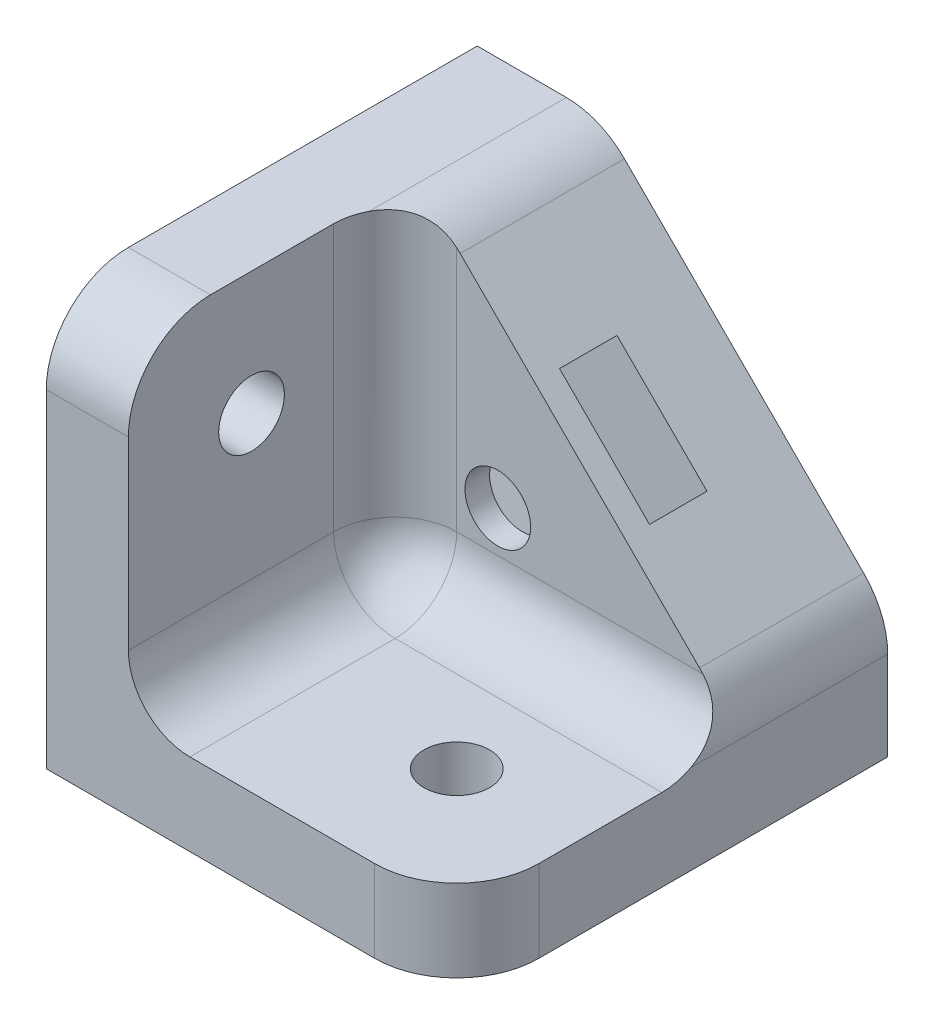
from build123d import *

# Parameters (mm, degrees)
BOSS_EXTRUDE4_DEPTH                  = 8
BOSS_EXTRUDE5_DEPTH                  = 21
SKETCH5_W                            = 2.8
SKETCH5_H                            = 6.2
CUT_EXTRUDE1_DEPTH                   = 9
F_3_2_3_2_DIAMETER_HOLE1_D           = 3.2
F_3_2_3_2_DIAMETER_HOLE1_ON_FACE_2_D = 3.2
F_3_2_3_2_DIAMETER_HOLE1_ON_FACE_3_D = 3.2
CHAMFER1_SIZE                        = 1.5
FILLET1_R                            = 3
FILLET2_R                            = 4


with BuildPart() as part:
    # Sketch4 → Boss-Extrude4 (new body)
    with BuildSketch(Plane.XY):
        Polygon((0, 20), (0, 0), (20, 0), (20, 6), (6, 20), align=None)
    extrude(amount=BOSS_EXTRUDE4_DEPTH)

    # Sketch4<4> → Boss-Extrude5 (add)
    with BuildSketch(Plane.XY):
        Polygon((0, 20), (0, 0), (20, 0), (20, 4), (4, 4), (4, 20), align=None)
    extrude(amount=BOSS_EXTRUDE5_DEPTH)

    # Sketch5 → Cut-Extrude1 (cut)
    with BuildSketch(Plane(origin=(13, 13, 0), x_dir=(0, 0, -1), z_dir=(0.7071067811865477, 0.7071067811865475, 0))):
        with Locations((-5.4, 0)):
            Rectangle(SKETCH5_W, SKETCH5_H)
    extrude(amount=-CUT_EXTRUDE1_DEPTH, mode=Mode.SUBTRACT)

    # Ø3.2 (3.2) Diameter Hole1 (through all)
    with Locations(Plane(origin=(14, 0, 15), x_dir=(0, 0, -1), z_dir=(0, -1, 0))):
        with Locations((0, 0)):
            Hole(F_3_2_3_2_DIAMETER_HOLE1_D / 2)

    # Ø3.2 (3.2) Diameter Hole1 on face 2 (through all)
    with Locations(Plane(origin=(0, 14, 15), x_dir=(0, 0, -1), z_dir=(-1, 0, 0))):
        with Locations((0, 0)):
            Hole(F_3_2_3_2_DIAMETER_HOLE1_ON_FACE_2_D / 2)

    # Ø3.2 (3.2) Diameter Hole1 on face 3 (through all)
    with Locations(Plane(origin=(9, 9, 0), x_dir=(-1, 0, 0), z_dir=(0, 0, -1))):
        with Locations((0, 0)):
            Hole(F_3_2_3_2_DIAMETER_HOLE1_ON_FACE_3_D / 2)

    # Chamfer1
    chamfer1_edges = [part.edges().sort_by_distance(p)[0] for p in [
        (4.444007948, 8.828069991, 5.4),
        (8.828069991, 4.444007948, 5.4),
    ]]
    chamfer(chamfer1_edges, length=CHAMFER1_SIZE)

    # Fillet1
    fillet1_edges = [part.edges().sort_by_distance(p)[0] for p in [
        (12, 4, 8),
        (4, 4, 14.5),
        (4, 12, 8),
    ]]
    fillet(fillet1_edges, radius=FILLET1_R)

    # Fillet2
    fillet2_edges = [part.edges().sort_by_distance(p)[0] for p in [
        (6, 20, 4.085786438),
        (20, 6, 4.085786438),
        (20, 2, 21),
        (2, 20, 21),
    ]]
    fillet(fillet2_edges, radius=FILLET2_R)


solid = part.part
